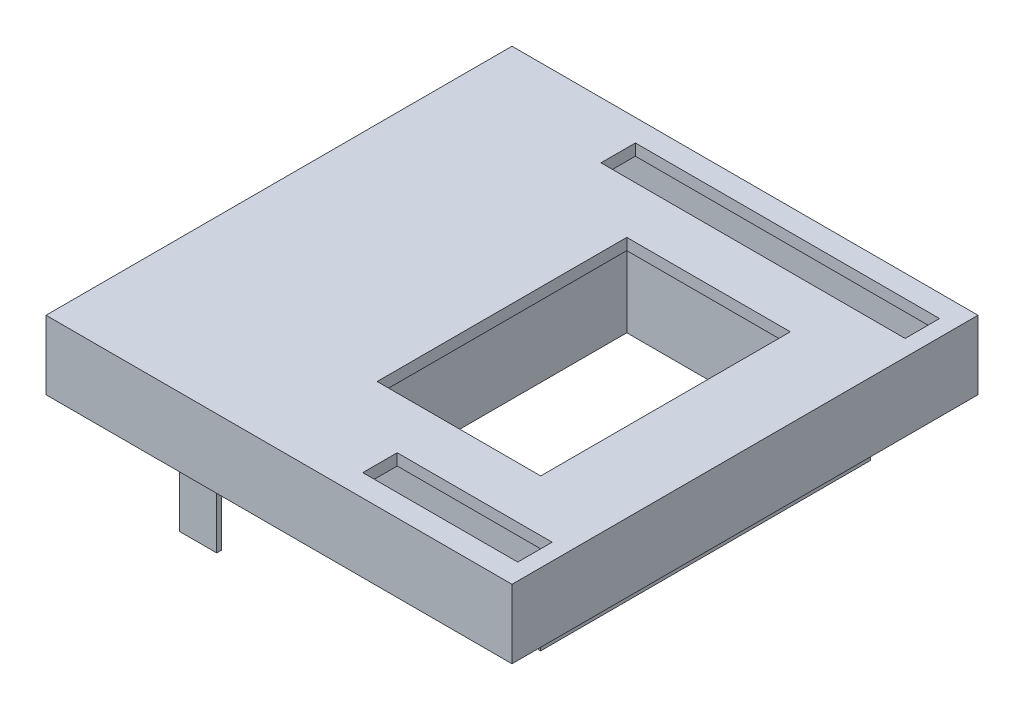
from build123d import *

# Parameters (mm, degrees)
SKETCH5_W                 = 81.2
SKETCH5_H                 = 81.2
BOSS_EXTRUDE3_DEPTH       = 2
SKETCH9_W                 = 81.2
SKETCH9_H                 = 81.2
SKETCH9_W_2               = 75.5
SKETCH9_H_2               = 75.5
BOSS_EXTRUDE5_DEPTH       = 5
SKETCH6_W                 = 42.5
SKETCH6_H                 = 57.5
SKETCH6_W_2               = 38.5
SKETCH6_H_2               = 53.5
BOSS_EXTRUDE4_DEPTH       = 17.4
SKETCH7_W                 = 28.5
SKETCH7_H                 = 43.5
SKETCH7_W_2               = 27
SKETCH7_H_2               = 6
SKETCH7_W_3               = 53
CUT_EXTRUDE1_DEPTH        = 2
SKETCH10_W                = 6.5
SKETCH10_H                = 0.85
BOSS_EXTRUDE6_DEPTH       = 15
BOSS_EXTRUDE7_OUTLINE_W   = 81.2
BOSS_EXTRUDE7_OUTLINE_H   = 81.2
BOSS_EXTRUDE7_OUTLINE_W_2 = 79.2
BOSS_EXTRUDE7_OUTLINE_H_2 = 79.2
BOSS_EXTRUDE7_OUTLINE_W_3 = 77.5
BOSS_EXTRUDE7_OUTLINE_H_3 = 77.5
BOSS_EXTRUDE7_OUTLINE_W_4 = 75.5
BOSS_EXTRUDE7_OUTLINE_H_4 = 75.5
BOSS_EXTRUDE7_DEPTH       = 5


# Read off the part's stored shape, not the designer's step: Boss-Extrude7
with BuildPart() as part:
    # Sketch5 → Boss-Extrude3 (new body)
    with BuildSketch(Plane(origin=(0, 0, 0), x_dir=(1, 0, 0), z_dir=(0, 1, 0))):
        with Locations((39.6, 39.6)):
            Rectangle(SKETCH5_W, SKETCH5_H)
    extrude(amount=BOSS_EXTRUDE3_DEPTH)

    # Sketch9 → Boss-Extrude5 (add)
    with BuildSketch(Plane.XZ):
        with Locations((39.6, -39.6)):
            Rectangle(SKETCH9_W, SKETCH9_H)
        with Locations((39.6, -39.6)):
            Rectangle(SKETCH9_W_2, SKETCH9_H_2, mode=Mode.SUBTRACT)
    extrude(amount=BOSS_EXTRUDE5_DEPTH)

    # Sketch6 → Boss-Extrude4 (add)
    with BuildSketch(Plane.XZ):
        with Locations((52.1, -39.6)):
            Rectangle(SKETCH6_W, SKETCH6_H)
        with Locations((52.1, -39.6)):
            Rectangle(SKETCH6_W_2, SKETCH6_H_2, mode=Mode.SUBTRACT)
    extrude(amount=BOSS_EXTRUDE4_DEPTH)

    # Sketch7 → Cut-Extrude1 (cut)
    with BuildSketch(Plane.XZ):
        with Locations((52.1, -39.6)):
            Rectangle(SKETCH7_W, SKETCH7_H)
        with Locations((63.85, -5.85)):
            Rectangle(SKETCH7_W_2, SKETCH7_H_2)
        with Locations((50.85, -73.35)):
            Rectangle(SKETCH7_W_3, SKETCH7_H_2)
    extrude(amount=-CUT_EXTRUDE1_DEPTH, mode=Mode.SUBTRACT)

    # Sketch10 → Boss-Extrude6 (add)
    with BuildSketch(Plane.XZ.offset(5)):
        with Locations((24.5, -0.425)):
            Rectangle(SKETCH10_W, SKETCH10_H)
    extrude(amount=BOSS_EXTRUDE6_DEPTH)

    # Boss-Extrude7 outline → Boss-Extrude7 (add)
    # profile 1 of 2: a face of its own
    with BuildSketch(Plane(origin=(0, -5, 0), x_dir=(-1, 0, 0), z_dir=(0, -1, 0))):
        with Locations((-39.6, 39.6)):
            Rectangle(BOSS_EXTRUDE7_OUTLINE_W, BOSS_EXTRUDE7_OUTLINE_H)
        with Locations((-39.6, 39.6)):
            Rectangle(BOSS_EXTRUDE7_OUTLINE_W_2, BOSS_EXTRUDE7_OUTLINE_H_2, mode=Mode.SUBTRACT)
    # profile 2 of 2: a face of its own
    with BuildSketch(Plane(origin=(0, -5, 0), x_dir=(-1, 0, 0), z_dir=(0, -1, 0))):
        with Locations((-39.6, 39.6)):
            Rectangle(BOSS_EXTRUDE7_OUTLINE_W_3, BOSS_EXTRUDE7_OUTLINE_H_3)
        with Locations((-39.6, 39.6)):
            Rectangle(BOSS_EXTRUDE7_OUTLINE_W_4, BOSS_EXTRUDE7_OUTLINE_H_4, mode=Mode.SUBTRACT)
    extrude(amount=BOSS_EXTRUDE7_DEPTH)


solid = part.part
